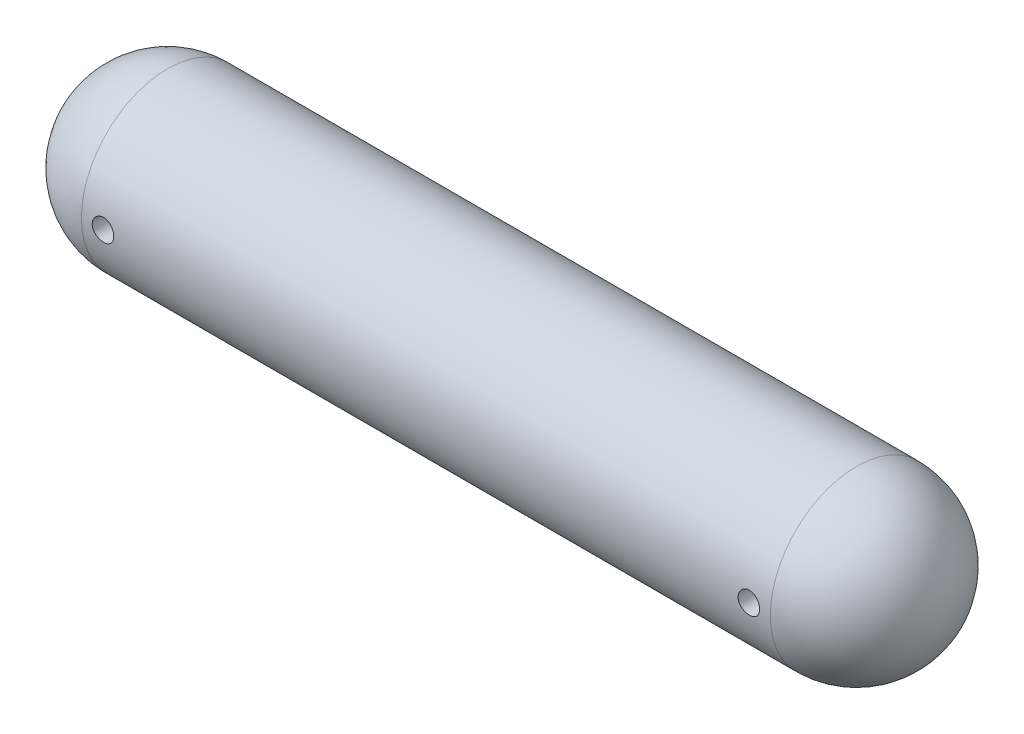
from build123d import *

# Parameters (mm, degrees)
CORTAR_EXTRUIR1_DEPTH      = 150.775651059
CORTAR_EXTRUIR1_DEPTH_BACK = 150.775651059
CROQUIS6_R                 = 2.5


with BuildPart() as part:
    # Croquis3 → Revolución10 (revolve)
    with BuildSketch(Plane(origin=(0, 0, 0), x_dir=(1, 0, 0), z_dir=(0, 1, 0))):
        with BuildLine():
            Line((-32.919254658, 20), (107.080745342, 20))
            Line((107.080745342, 20), (127.080745342, 20))
            ThreePointArc((127.080745342, 20), (141.222880965, 14.142135624), (147.080745342, 0))
            Line((147.080745342, 0), (-52.919254658, 0))
            ThreePointArc((-52.919254658, 0), (-47.061390282, 14.142135624), (-32.919254658, 20))
        make_face()
    revolve(axis=Axis((-63.085280919, 0, 0), (1, 0, 0)))

    # Croquis6 → Cortar-Extruir1 (cut, two sides: drawn at the far end of the back side and taken through both)
    with BuildSketch(Plane.XY.offset(-CORTAR_EXTRUIR1_DEPTH_BACK)):
        with Locations((-27.919254658, 0)):
            Circle(CROQUIS6_R)
        with Locations((122.080745342, 0)):
            Circle(CROQUIS6_R)
    extrude(amount=CORTAR_EXTRUIR1_DEPTH + CORTAR_EXTRUIR1_DEPTH_BACK, mode=Mode.SUBTRACT)


solid = part.part
